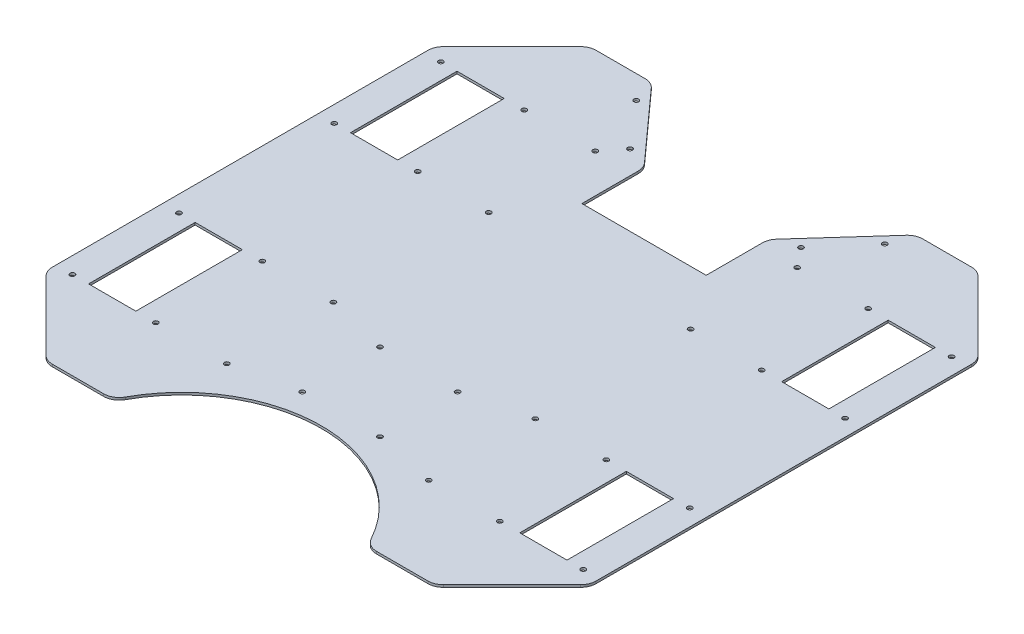
from build123d import *

# Parameters (mm, degrees)
SKETCH_1_R      = 1.55
SKETCH_1_W      = 30.4
SKETCH_1_H      = 68.58
EXTRUDE_1_DEPTH = 1.5
FILLET_1_R      = 10
FILLET_2_R      = 10
FILLET_3_R      = 10


with BuildPart() as part:
    # 草图1 → 凸台-拉伸1 (new body)
    with BuildSketch(Plane(origin=(0, 0, 0), x_dir=(1, 0, 0), z_dir=(0, 1, 0))):
        with BuildLine():
            Line((-125, 175), (-175, 125))
            Line((-175, 125), (-175, -125))
            Line((-175, -125), (-125, -175))
            Line((-125, -175), (-81.710313025, -175))
            ThreePointArc((-81.710313025, -175), (0, -122.728301649), (81.710313025, -175))
            Line((81.710313025, -175), (125, -175))
            Line((125, -175), (175, -125))
            Line((175, -125), (175, 125))
            Line((175, 125), (125, 175))
            Line((125, 175), (85, 175))
            Line((85, 175), (40, 125))
            Line((40, 125), (40, 85))
            Line((40, 85), (-40, 85))
            Line((-40, 85), (-40, 125))
            Line((-40, 125), (-85, 175))
            Line((-85, 175), (-125, 175))
        make_face()
        with Locations((-55, 131)):
            Circle(SKETCH_1_R, mode=Mode.SUBTRACT)
        with Locations((-80, 160)):
            Circle(SKETCH_1_R, mode=Mode.SUBTRACT)
        with Locations((55, 131)):
            Circle(SKETCH_1_R, mode=Mode.SUBTRACT)
        with Locations((80, 160)):
            Circle(SKETCH_1_R, mode=Mode.SUBTRACT)
        with Locations((-65, 118.58)):
            Circle(SKETCH_1_R, mode=Mode.SUBTRACT)
        with Locations((-65, 50)):
            Circle(SKETCH_1_R, mode=Mode.SUBTRACT)
        with Locations((-110.72, 50)):
            Circle(SKETCH_1_R, mode=Mode.SUBTRACT)
        with Locations((-110.72, 118.58)):
            Circle(SKETCH_1_R, mode=Mode.SUBTRACT)
        with Locations((-164.434, 118.58)):
            Circle(SKETCH_1_R, mode=Mode.SUBTRACT)
        with Locations((-164.434, 50)):
            Circle(SKETCH_1_R, mode=Mode.SUBTRACT)
        with Locations((-65, -118.58)):
            Circle(SKETCH_1_R, mode=Mode.SUBTRACT)
        with Locations((-65, -50)):
            Circle(SKETCH_1_R, mode=Mode.SUBTRACT)
        with Locations((-110.72, -50)):
            Circle(SKETCH_1_R, mode=Mode.SUBTRACT)
        with Locations((-110.72, -118.58)):
            Circle(SKETCH_1_R, mode=Mode.SUBTRACT)
        with Locations((-164.434, -50)):
            Circle(SKETCH_1_R, mode=Mode.SUBTRACT)
        with Locations((-164.434, -118.58)):
            Circle(SKETCH_1_R, mode=Mode.SUBTRACT)
        with Locations((65, 50)):
            Circle(SKETCH_1_R, mode=Mode.SUBTRACT)
        with Locations((110.72, 50)):
            Circle(SKETCH_1_R, mode=Mode.SUBTRACT)
        with Locations((110.72, 118.58)):
            Circle(SKETCH_1_R, mode=Mode.SUBTRACT)
        with Locations((65, 118.58)):
            Circle(SKETCH_1_R, mode=Mode.SUBTRACT)
        with Locations((164.434, 118.58)):
            Circle(SKETCH_1_R, mode=Mode.SUBTRACT)
        with Locations((164.434, 50)):
            Circle(SKETCH_1_R, mode=Mode.SUBTRACT)
        with Locations((164.434, -118.58)):
            Circle(SKETCH_1_R, mode=Mode.SUBTRACT)
        with Locations((164.434, -50)):
            Circle(SKETCH_1_R, mode=Mode.SUBTRACT)
        with Locations((110.72, -50)):
            Circle(SKETCH_1_R, mode=Mode.SUBTRACT)
        with Locations((110.72, -118.58)):
            Circle(SKETCH_1_R, mode=Mode.SUBTRACT)
        with Locations((65, -118.58)):
            Circle(SKETCH_1_R, mode=Mode.SUBTRACT)
        with Locations((65, -50)):
            Circle(SKETCH_1_R, mode=Mode.SUBTRACT)
        with Locations((25, -60)):
            Circle(SKETCH_1_R, mode=Mode.SUBTRACT)
        with Locations((25, -110)):
            Circle(SKETCH_1_R, mode=Mode.SUBTRACT)
        with Locations((-25, -60)):
            Circle(SKETCH_1_R, mode=Mode.SUBTRACT)
        with Locations((-25, -110)):
            Circle(SKETCH_1_R, mode=Mode.SUBTRACT)
        with Locations((-138.794, 84.29)):
            Rectangle(SKETCH_1_W, SKETCH_1_H, mode=Mode.SUBTRACT)
        with Locations((138.794, 84.29)):
            Rectangle(SKETCH_1_W, SKETCH_1_H, mode=Mode.SUBTRACT)
        with Locations((-138.794, -84.29)):
            Rectangle(SKETCH_1_W, SKETCH_1_H, mode=Mode.SUBTRACT)
        with Locations((138.794, -84.29)):
            Rectangle(SKETCH_1_W, SKETCH_1_H, mode=Mode.SUBTRACT)
    extrude(amount=EXTRUDE_1_DEPTH)

    # 圆角1
    fillet_1_edges = [part.edges().sort_by_distance(p)[0] for p in [
        (-40, 0.75, -125),
    ]]
    fillet(fillet_1_edges, radius=FILLET_1_R)

    # 圆角2
    fillet_2_edges = [part.edges().sort_by_distance(p)[0] for p in [
        (40, 0.75, -125),
    ]]
    fillet(fillet_2_edges, radius=FILLET_2_R)

    # 圆角3
    fillet_3_edges = [part.edges().sort_by_distance(p)[0] for p in [
        (-85, 0.75, -175),
        (85, 0.75, -175),
        (125, 0.75, -175),
        (175, 0.75, -125),
        (175, 0.75, 125),
        (125, 0.75, 175),
        (81.710313025, 0.75, 175),
        (-81.710313025, 0.75, 175),
        (-125, 0.75, 175),
        (-175, 0.75, 125),
        (-175, 0.75, -125),
        (-125, 0.75, -175),
    ]]
    fillet(fillet_3_edges, radius=FILLET_3_R)


solid = part.part
